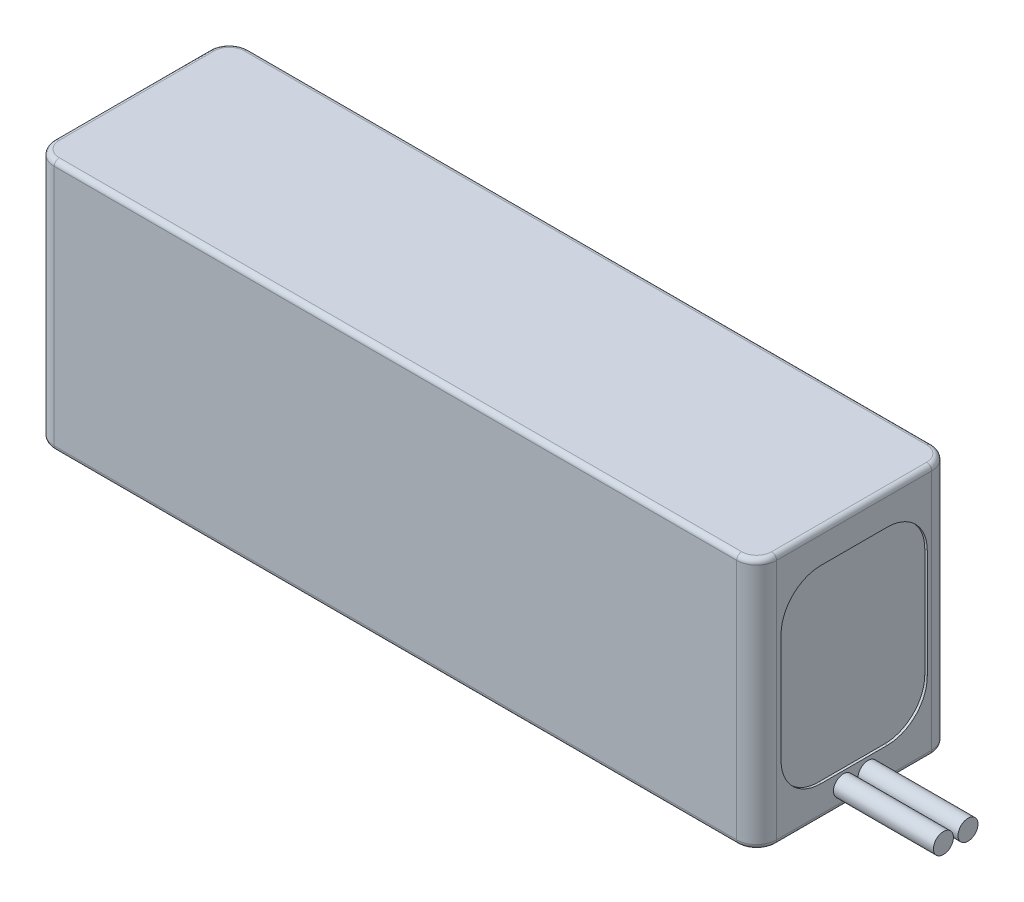
from build123d import *

# Parameters (mm, degrees)
SKETCH1_W           = 144.5
SKETCH1_H           = 50.4
BOSS_EXTRUDE1_DEPTH = 39
CUT_EXTRUDE1_DEPTH  = 0.5
CUT_EXTRUDE2_START  = -0.5
CUT_EXTRUDE2_DEPTH  = 0.5
FILLET1_R           = 4
FILLET2_R           = 1
SKETCH5_R           = 2
BOSS_EXTRUDE2_DEPTH = 20
SKETCH6_R           = 2
BOSS_EXTRUDE3_DEPTH = 20


with BuildPart() as part:
    # Sketch1 → Boss-Extrude1 (new body)
    with BuildSketch(Plane(origin=(0, 0, -15), x_dir=(-1, 0, 0), z_dir=(0, 0, -1))):
        with Locations((3.25, 3.2)):
            Rectangle(SKETCH1_W, SKETCH1_H)
    extrude(amount=-BOSS_EXTRUDE1_DEPTH)

    # Sketch2 → Cut-Extrude1 (cut)
    with BuildSketch(Plane(origin=(69, 0, 0), x_dir=(0, 0, -1), z_dir=(1, 0, 0))):
        with BuildLine():
            Line((-19.125, 14.1), (-19.125, -7.7))
            ThreePointArc((-19.125, -7.7), (-16.781854249, -13.356854249), (-11.125, -15.7))
            Line((-11.125, -15.7), (2.125, -15.7))
            ThreePointArc((2.125, -15.7), (7.781854249, -13.356854249), (10.125, -7.7))
            Line((10.125, -7.7), (10.125, 14.1))
            ThreePointArc((10.125, 14.1), (7.781854249, 19.756854249), (2.125, 22.1))
            Line((2.125, 22.1), (-11.125, 22.1))
            ThreePointArc((-11.125, 22.1), (-16.781854249, 19.756854249), (-19.125, 14.1))
        make_face()
    extrude(amount=-CUT_EXTRUDE1_DEPTH, mode=Mode.SUBTRACT)

    # Sketch3 → Cut-Extrude2 (cut)
    with BuildSketch(Plane.ZY.offset(75.5).offset(CUT_EXTRUDE2_START)):
        with BuildLine():
            Line((11.125, 22.1), (-2.125, 22.1))
            ThreePointArc((-2.125, 22.1), (-7.781854249, 19.756854249), (-10.125, 14.1))
            Line((-10.125, 14.1), (-10.125, -7.7))
            ThreePointArc((-10.125, -7.7), (-7.781854249, -13.356854249), (-2.125, -15.7))
            Line((-2.125, -15.7), (11.125, -15.7))
            ThreePointArc((11.125, -15.7), (16.781854249, -13.356854249), (19.125, -7.7))
            Line((19.125, -7.7), (19.125, 14.1))
            ThreePointArc((19.125, 14.1), (16.781854249, 19.756854249), (11.125, 22.1))
        make_face()
    extrude(amount=CUT_EXTRUDE2_DEPTH, mode=Mode.SUBTRACT)

    # Fillet1
    fillet1_edges = [part.edges().sort_by_distance(p)[0] for p in [
        (-75.5, 3.2, -15),
        (-75.5, 3.2, 24),
        (69, 3.2, -15),
        (69, 3.2, 24),
    ]]
    fillet(fillet1_edges, radius=FILLET1_R)

    # Fillet2
    fillet2_edges = [part.edges().sort_by_distance(p)[0] for p in [
        (67.828427125, 28.4, -13.828427125),
        (69, 28.4, 4.5),
        (-3.25, 28.4, -15),
        (67.828427125, 28.4, 22.828427125),
        (-74.328427125, 28.4, -13.828427125),
        (-3.25, 28.4, 24),
        (-75.5, 28.4, 4.5),
        (-74.328427125, 28.4, 22.828427125),
        (-75.5, -22, 4.5),
        (-74.328427125, -22, -13.828427125),
        (-74.328427125, -22, 22.828427125),
        (-3.25, -22, -15),
        (-3.25, -22, 24),
        (67.828427125, -22, -13.828427125),
        (67.828427125, -22, 22.828427125),
        (69, -22, 4.5),
    ]]
    fillet(fillet2_edges, radius=FILLET2_R)

    # Sketch5 → Boss-Extrude2 (add)
    with BuildSketch(Plane(origin=(69, 0, 0), x_dir=(0, 0, -1), z_dir=(1, 0, 0))):
        with Locations((-1.727235472, -18.404289653)):
            Circle(SKETCH5_R)
    extrude(amount=BOSS_EXTRUDE2_DEPTH)

    # Sketch6 → Boss-Extrude3 (add)
    with BuildSketch(Plane(origin=(69, 0, 0), x_dir=(0, 0, -1), z_dir=(1, 0, 0))):
        with Locations((-6.641010829, -18.252851371)):
            Circle(SKETCH6_R)
    extrude(amount=BOSS_EXTRUDE3_DEPTH)


solid = part.part
